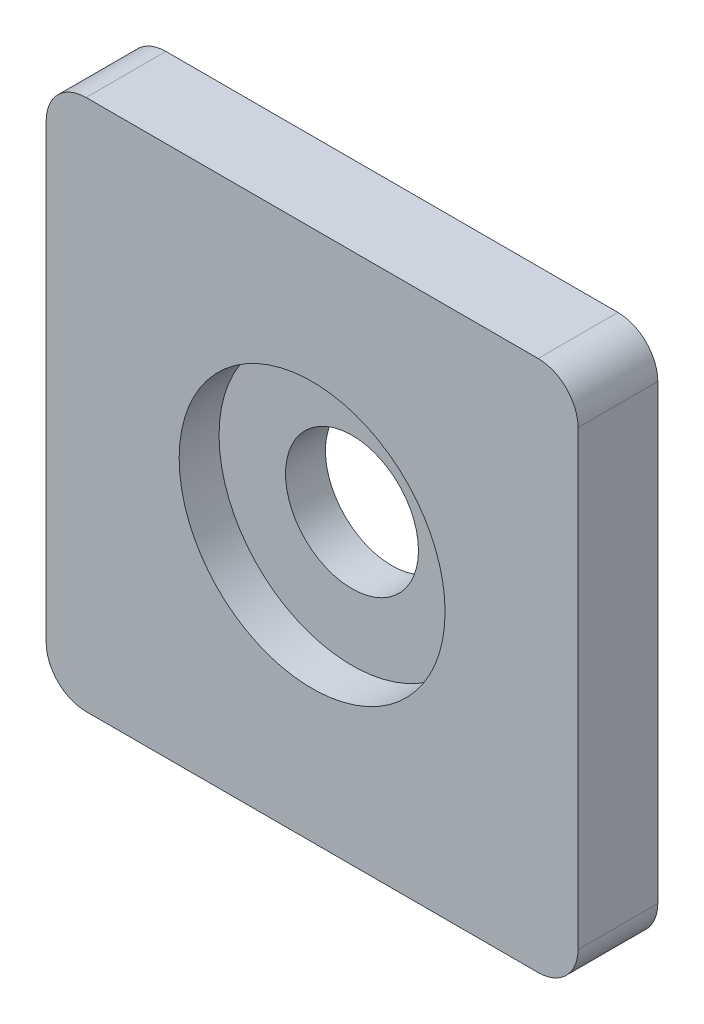
from build123d import *

# Parameters (mm, degrees)
SKETCH1_W           = 20
SKETCH1_H           = 20
SKETCH1_R           = 2.5
BOSS_EXTRUDE1_DEPTH = 3
SKETCH2_R           = 5
CUT_EXTRUDE1_DEPTH  = 1.5
FILLET1_R           = 1.5


with BuildPart() as part:
    # Sketch1 → Boss-Extrude1 (new body)
    with BuildSketch(Plane.XY):
        Rectangle(SKETCH1_W, SKETCH1_H)
        Circle(SKETCH1_R, mode=Mode.SUBTRACT)
    extrude(amount=BOSS_EXTRUDE1_DEPTH)

    # Sketch2 → Cut-Extrude1 (cut)
    with BuildSketch(Plane.XY.offset(3)):
        Circle(SKETCH2_R)
    extrude(amount=-CUT_EXTRUDE1_DEPTH, mode=Mode.SUBTRACT)

    # Fillet1
    fillet1_edges = [part.edges().sort_by_distance(p)[0] for p in [
        (10, 10, 1.5),
        (10, -10, 1.5),
        (-10, -10, 1.5),
        (-10, 10, 1.5),
    ]]
    fillet(fillet1_edges, radius=FILLET1_R)


solid = part.part
